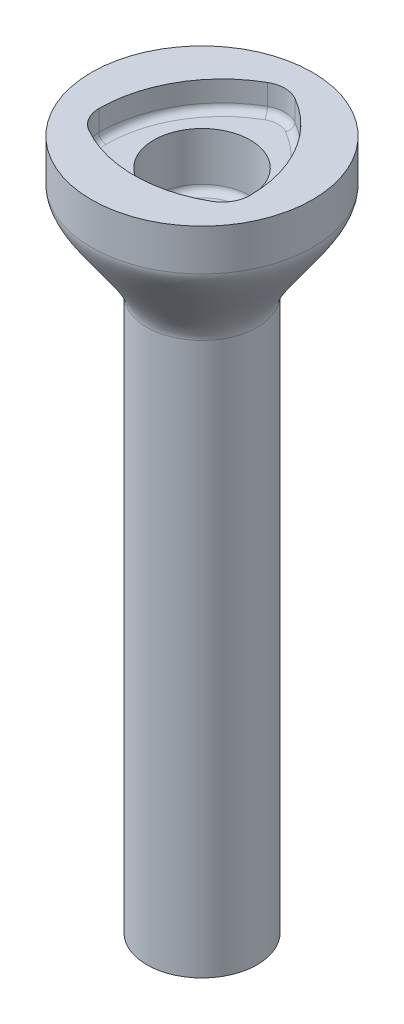
from build123d import *

# Parameters (mm, degrees)
CUT_EXTRUDE1_DEPTH = 4
SKETCH8_R          = 7
CUT_EXTRUDE2_DEPTH = 8
FILLET1_R          = 1


with BuildPart() as part:
    # Sketch6 → Revolve1 (revolve)
    with BuildSketch(Plane.XY):
        with BuildLine():
            Line((0, 0), (-8, 0))
            Line((-8, 0), (-8, 80))
            add(Edge.make_bspline(
                [(-16, 94), (-16, 91), (-8, 83), (-8, 80)],
                knots=[0, 0, 0, 0, 1, 1, 1, 1], degree=3))
            Line((-16, 94), (-16, 100))
            Line((-16, 100), (0, 100))
            Line((0, 100), (0, 0))
        make_face()
    revolve(axis=Axis((0, 0, 0), (0, 1, 0)))

    # Sketch7 → Cut-Extrude1 (cut)
    with BuildSketch(Plane(origin=(0, 100, 0), x_dir=(1, 0, 0), z_dir=(0, 1, 0))):
        with BuildLine():
            ThreePointArc((-2, 11.464101615), (0, 12), (2, 11.464101615))
            ThreePointArc((2, 11.464101615), (8.535898385, 4.92820323), (10.92820323, -4))
            ThreePointArc((10.92820323, -4), (10.392304845, -6), (8.92820323, -7.464101615))
            ThreePointArc((8.92820323, -7.464101615), (0, -9.856406461), (-8.92820323, -7.464101615))
            ThreePointArc((-8.92820323, -7.464101615), (-10.392304845, -6), (-10.92820323, -4))
            ThreePointArc((-10.92820323, -4), (-8.535898385, 4.92820323), (-2, 11.464101615))
        make_face()
    extrude(amount=-CUT_EXTRUDE1_DEPTH, mode=Mode.SUBTRACT)

    # Sketch8 → Cut-Extrude2 (cut)
    with BuildSketch(Plane(origin=(0, 96, 0), x_dir=(1, 0, 0), z_dir=(0, 1, 0))):
        Circle(SKETCH8_R)
    extrude(amount=-CUT_EXTRUDE2_DEPTH, mode=Mode.SUBTRACT)

    # Fillet1
    fillet1_edges = [part.edges().sort_by_distance(p)[0] for p in [
        (-10.392304845, 96, 6),
        (-8.535898385, 96, -4.92820323),
        (0, 96, -12),
        (8.535898385, 96, -4.92820323),
        (10.392304845, 96, 6),
        (-7, 88, 0),
        (0, 96, 9.856406461),
    ]]
    fillet(fillet1_edges, radius=FILLET1_R)


solid = part.part
